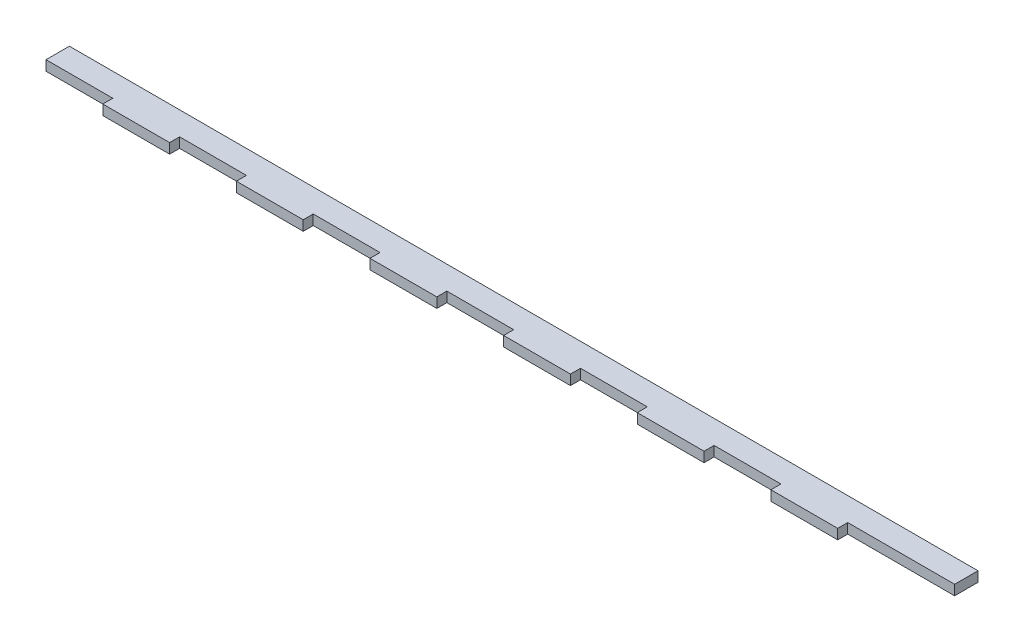
from build123d import *

# Parameters (mm, degrees)
CROQUIS1_W              = 544
CROQUIS1_H              = 20
SALIENTE_EXTRUIR1_DEPTH = 6
CROQUIS3_W              = 40
CROQUIS3_H              = 6
CORTAR_EXTRUIR1_DEPTH   = 6
MATRIZL1_COUNT          = 7
MATRIZL1_PITCH          = 80
CROQUIS4_W              = 24
CROQUIS4_H              = 6
CORTAR_EXTRUIR2_DEPTH   = 6


with BuildPart() as part:
    # Croquis1 → Saliente-Extruir1 (new body)
    with BuildSketch(Plane(origin=(0, 0, 0), x_dir=(1, 0, 0), z_dir=(0, 1, 0))):
        with Locations((272, 10)):
            Rectangle(CROQUIS1_W, CROQUIS1_H)
    extrude(amount=SALIENTE_EXTRUIR1_DEPTH)

    # Croquis3 → Cortar-Extruir1 (cut)
    with BuildSketch(Plane(origin=(0, 0, 0), x_dir=(1, 0, 0), z_dir=(0, 1, 0))):
        with Locations((20, 3)):
            Rectangle(CROQUIS3_W, CROQUIS3_H)
    cortar_extruir1 = extrude(amount=CORTAR_EXTRUIR1_DEPTH, mode=Mode.SUBTRACT)

    # MatrizL1: Cortar-Extruir1 ×7
    with Locations(*[(i * MATRIZL1_PITCH, 0, 0) for i in range(1, MATRIZL1_COUNT)]):
        add(cortar_extruir1, mode=Mode.SUBTRACT)

    # Croquis4 → Cortar-Extruir2 (cut)
    with BuildSketch(Plane(origin=(0, 6, 0), x_dir=(1, 0, 0), z_dir=(0, 1, 0))):
        with Locations((532, 3)):
            Rectangle(CROQUIS4_W, CROQUIS4_H)
    extrude(amount=-CORTAR_EXTRUIR2_DEPTH, mode=Mode.SUBTRACT)


solid = part.part
